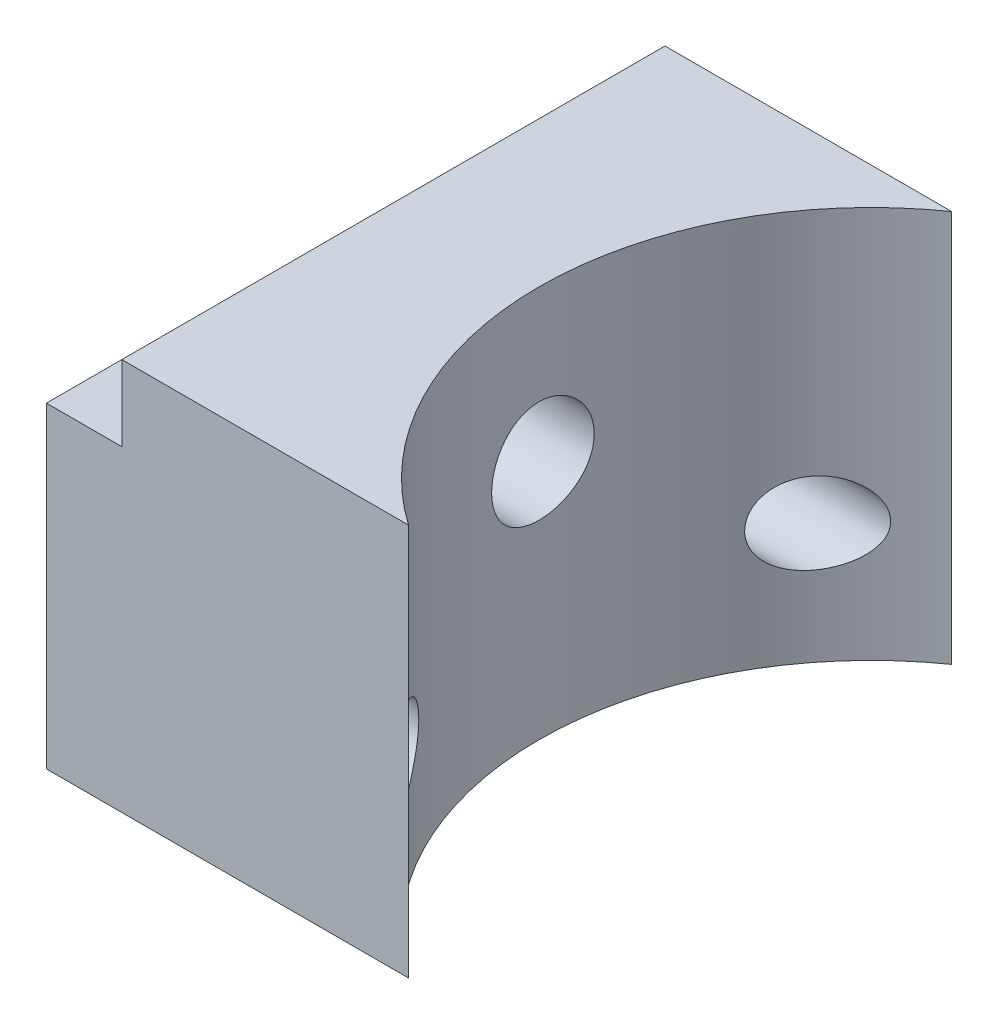
from build123d import *

# Parameters (mm, degrees)
BOSS_EXTRUDE1_DEPTH        = 13
F_2_7_2_7_DIAMETER_HOLE1_D = 2.7
SKETCH15_W                 = 18
SKETCH15_H                 = 2.5
CUT_EXTRUDE1_DEPTH         = 2.5


# Read off the part's stored shape, not the designer's step: CSK for M3 SFHCS1
with BuildPart() as part:
    # Sketch1 → Boss-Extrude1 (new body)
    with BuildSketch(Plane(origin=(0, 0, 0), x_dir=(1, 0, 0), z_dir=(0, 1, 0))):
        with BuildLine():
            Line((0, 9), (0, -9))
            Line((0, -9), (12, -9))
            ThreePointArc((12, -9), (7.32455532, 0), (12, 9))
            Line((12, 9), (0, 9))
        make_face()
    extrude(amount=BOSS_EXTRUDE1_DEPTH)

    # CSK for M3 SFHCS1 outline → CSK for M3 SFHCS1 (revolve, cut)
    with BuildSketch(Plane(origin=(0, 8, 0), x_dir=(0, 1, 0), z_dir=(0, 0, -1))):
        Polygon((1.7, 4.66), (1.7, 7.456784973), (0, 7.456784973), (0, 0), (3.36, 0), (3.36, 3), align=None)
    revolve(axis=Axis((0, 8, 0), (1, 0, 0)), mode=Mode.SUBTRACT)

    # Ø2.7 (2.7) Diameter Hole1 (through all)
    with Locations(Plane.ZY):
        with Locations((-6.75, 4), (6.75, 4)):
            Hole(F_2_7_2_7_DIAMETER_HOLE1_D / 2)

    # Sketch15 → Cut-Extrude1 (cut)
    with BuildSketch(Plane.ZY):
        with Locations((0, 11.75)):
            Rectangle(SKETCH15_W, SKETCH15_H)
    extrude(amount=-CUT_EXTRUDE1_DEPTH, mode=Mode.SUBTRACT)


solid = part.part
